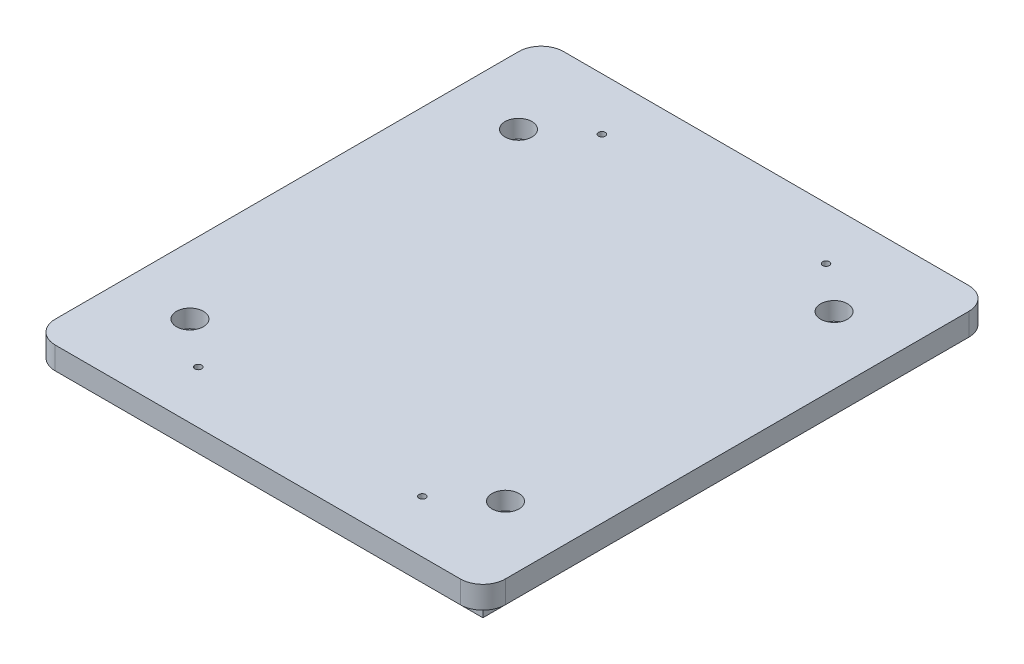
from build123d import *

# Parameters (mm, degrees)
SKETCH1_W           = 100.4
SKETCH1_H           = 113.4
BOSS_EXTRUDE1_DEPTH = 5
SKETCH2_W           = 90.4
SKETCH2_H           = 103.4
BOSS_EXTRUDE2_DEPTH = 5
FILLET1_R           = 5
SKETCH3_R           = 1.5
CUT_EXTRUDE1_DEPTH  = 17
SKETCH4_R           = 3
CUT_EXTRUDE2_DEPTH  = 4
SKETCH5_R           = 0.75
CUT_EXTRUDE3_DEPTH  = 19


with BuildPart() as part:
    # Sketch1 → Boss-Extrude1 (new body)
    with BuildSketch(Plane(origin=(0, 0, 0), x_dir=(1, 0, 0), z_dir=(0, 1, 0))):
        Rectangle(SKETCH1_W, SKETCH1_H)
    extrude(amount=BOSS_EXTRUDE1_DEPTH)

    # Sketch2 → Boss-Extrude2 (add)
    with BuildSketch(Plane.XZ):
        Rectangle(SKETCH2_W, SKETCH2_H)
    extrude(amount=BOSS_EXTRUDE2_DEPTH)

    # Fillet1
    fillet1_edges = [part.edges().sort_by_distance(p)[0] for p in [
        (-50.2, 2.5, -56.7),
        (50.2, 2.5, -56.7),
        (50.2, 2.5, 56.7),
        (-50.2, 2.5, 56.7),
    ]]
    fillet(fillet1_edges, radius=FILLET1_R)

    # Sketch3 → Cut-Extrude1 (cut)
    with BuildSketch(Plane(origin=(0, 5, 0), x_dir=(1, 0, 0), z_dir=(0, 1, 0))):
        with Locations((-35.2, 36.65)):
            Circle(SKETCH3_R)
        with Locations((-35.2, -36.65)):
            Circle(SKETCH3_R)
        with Locations((35.2, 36.65)):
            Circle(SKETCH3_R)
        with Locations((35.2, -36.65)):
            Circle(SKETCH3_R)
    extrude(amount=-CUT_EXTRUDE1_DEPTH, mode=Mode.SUBTRACT)

    # Sketch4 → Cut-Extrude2 (cut)
    with BuildSketch(Plane(origin=(0, 5, 0), x_dir=(1, 0, 0), z_dir=(0, 1, 0))):
        with Locations((-35.2, 36.65)):
            Circle(SKETCH4_R)
        with Locations((-35.2, -36.65)):
            Circle(SKETCH4_R)
        with Locations((35.2, 36.65)):
            Circle(SKETCH4_R)
        with Locations((35.2, -36.65)):
            Circle(SKETCH4_R)
    extrude(amount=-CUT_EXTRUDE2_DEPTH, mode=Mode.SUBTRACT)

    # Sketch5 → Cut-Extrude3 (cut)
    with BuildSketch(Plane(origin=(0, 5, 0), x_dir=(1, 0, 0), z_dir=(0, 1, 0))):
        with Locations((-24.945666125, 44.999983599)):
            Circle(SKETCH5_R)
        with Locations((-25, -45)):
            Circle(SKETCH5_R)
        with Locations((25.054333875, 45)):
            Circle(SKETCH5_R)
        with Locations((25, -44.999983599)):
            Circle(SKETCH5_R)
    extrude(amount=-CUT_EXTRUDE3_DEPTH, mode=Mode.SUBTRACT)


solid = part.part
